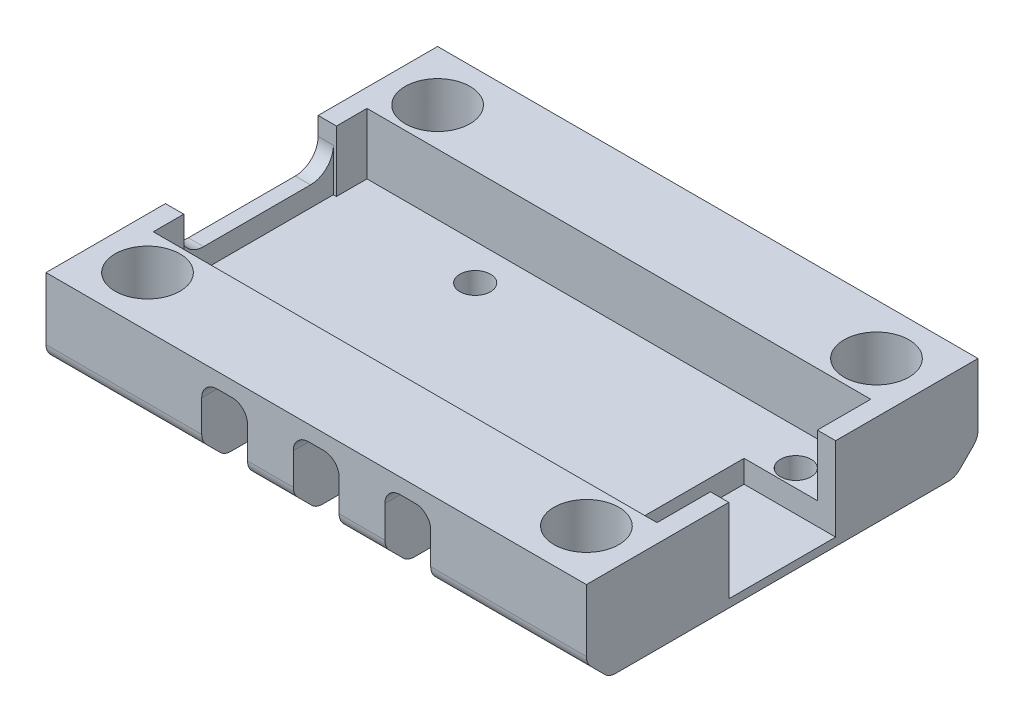
from build123d import *

# Parameters (mm, degrees)
SKETCH1_W           = 35.4
SKETCH1_H           = 25.65
SKETCH1_R           = 2.125
BOSS_EXTRUDE1_DEPTH = 2
SKETCH1_3_R         = 2.125
BOSS_EXTRUDE2_DEPTH = 6
SKETCH2_W           = 3
SKETCH2_H           = 4.5
CUT_EXTRUDE1_DEPTH  = 5
CHAMFER1_SIZE       = 1.5
FILLET1_R           = 1
SKETCH3_W           = 7
SKETCH3_H           = 5.470677448
CUT_EXTRUDE2_DEPTH  = 6
SKETCH4_R           = 1
CUT_EXTRUDE3_DEPTH  = 2
SKETCH5_W           = 10
SKETCH5_H           = 1.310302081
BOSS_EXTRUDE3_DEPTH = 1
FILLET2_R           = 1.5


with BuildPart() as part:
    # Sketch1 → Boss-Extrude1 (new body)
    with BuildSketch(Plane(origin=(0, 0, 0), x_dir=(1, 0, 0), z_dir=(0, 1, 0))):
        with Locations((16.5, 7)):
            Rectangle(SKETCH1_W, SKETCH1_H)
        with Locations(Location((2.125, 16.5, 0), (0, 0, 270))):
            Circle(SKETCH1_R, mode=Mode.SUBTRACT)
        with Locations(Location((2.125, -2.5, 0), (0, 0, 270))):
            Circle(SKETCH1_R, mode=Mode.SUBTRACT)
        with Locations(Location((30.875, -2.5, 0), (0, 0, 270))):
            Circle(SKETCH1_R, mode=Mode.SUBTRACT)
        with Locations(Location((30.875, 16.5, 0), (0, 0, 270))):
            Circle(SKETCH1_R, mode=Mode.SUBTRACT)
    extrude(amount=BOSS_EXTRUDE1_DEPTH)

    # Sketch1<3> → Boss-Extrude2 (add)
    # profile 1 of 2: a face of its own
    with BuildSketch(Plane(origin=(0, 0, 0), x_dir=(1, 0, 0), z_dir=(0, 1, 0))):
        Polygon((33, 0), (0, 0), (0, 2), (-1.2, 2), (-1.2, -5.825), (34.2, -5.825), (34.2, 3.5), (33, 3.5), align=None)
        with Locations(Location((2.125, -2.5, 0), (0, 0, 270))):
            Circle(SKETCH1_3_R, mode=Mode.SUBTRACT)
        with Locations(Location((30.875, -2.5, 0), (0, 0, 270))):
            Circle(SKETCH1_3_R, mode=Mode.SUBTRACT)
    # profile 2 of 2: a face of its own
    with BuildSketch(Plane(origin=(0, 0, 0), x_dir=(1, 0, 0), z_dir=(0, 1, 0))):
        Polygon((-1.2, 12), (0, 12), (0, 14), (33, 14), (33, 10.5), (34.2, 10.5), (34.2, 19.825), (-1.2, 19.825), align=None)
        with Locations(Location((2.125, 16.5, 0), (0, 0, 270))):
            Circle(SKETCH1_3_R, mode=Mode.SUBTRACT)
        with Locations(Location((30.875, 16.5, 0), (0, 0, 270))):
            Circle(SKETCH1_3_R, mode=Mode.SUBTRACT)
    extrude(amount=BOSS_EXTRUDE2_DEPTH)

    # Sketch2 → Cut-Extrude1 (cut)
    with BuildSketch(Plane(origin=(0, 0, 0), x_dir=(-1, 0, 0), z_dir=(0, -1, 0))):
        with Locations((-10.5, -3.575)):
            Rectangle(SKETCH2_W, SKETCH2_H)
        with Locations((-16.5, -3.575)):
            Rectangle(SKETCH2_W, SKETCH2_H)
        with Locations((-22.5, -3.575)):
            Rectangle(SKETCH2_W, SKETCH2_H)
        with Locations((-22.5, 17.575)):
            Rectangle(SKETCH2_W, SKETCH2_H)
        with Locations((-16.5, 17.575)):
            Rectangle(SKETCH2_W, SKETCH2_H)
        with Locations((-10.5, 17.575)):
            Rectangle(SKETCH2_W, SKETCH2_H)
    extrude(amount=-CUT_EXTRUDE1_DEPTH, mode=Mode.SUBTRACT)

    # Chamfer1
    # the kernel refuses this chamfer: 1.5 mm, written as the material it adds along each edge
    with BuildSketch(Plane(origin=(5.142475518, 5, -15.325), x_dir=(0, -0.9996219169112968, 0.027495876610586775), z_dir=(1, 0, 0)), Plane(origin=(11.142475518, 5, -15.325), x_dir=(0, -0.9996219169112968, 0.027495876610586775), z_dir=(1, 0, 0)), Plane(origin=(17.142475518, 5, -15.325), x_dir=(0, -0.9996219169112968, 0.027495876610586775), z_dir=(1, 0, 0)), Plane(origin=(5.142475518, 5, 1.325), x_dir=(0, 0.0274958766105862, 0.9996219169112968), z_dir=(1, 0, 0))) as chamfer1_piece_1:
        Polygon((CHAMFER1_SIZE * 0.999621916911, CHAMFER1_SIZE * 0.0274958766106), (-CHAMFER1_SIZE * 0.0274958766106, CHAMFER1_SIZE * 0.999621916911), (0, 0), align=None)
    extrude(amount=10.715048964)
    with BuildSketch(Plane(origin=(27.857524482, 5, 1.325), x_dir=(0, 0.0274958766105862, 0.9996219169112968), z_dir=(-1, 0, 0)), Plane(origin=(21.857524482, 5, 1.325), x_dir=(0, 0.0274958766105862, 0.9996219169112968), z_dir=(-1, 0, 0))) as chamfer1_piece_2:
        Polygon((CHAMFER1_SIZE * 0.999621916911, -CHAMFER1_SIZE * 0.0274958766106), (-CHAMFER1_SIZE * 0.0274958766106, -CHAMFER1_SIZE * 0.999621916911), (0, 0), align=None)
    extrude(amount=10.715048964)
    # the kernel refuses this chamfer: 1.5 mm, written as the material it takes off along each edge
    with BuildSketch(Plane(origin=(18.857524482, 0, -19.825), x_dir=(0, 0.9996219169112968, -0.027495876610586778), z_dir=(-1, 0, 0)), Plane(origin=(24.857524482, 0, -19.825), x_dir=(0, 0.9996219169112968, -0.027495876610586778), z_dir=(-1, 0, 0)), Plane(origin=(8.142475518, 0, 5.825), x_dir=(0, 0.9996219169112968, 0.027495876610586202), z_dir=(1, 0, 0)), Plane(origin=(14.142475518, 0, 5.825), x_dir=(0, 0.9996219169112968, 0.027495876610586202), z_dir=(1, 0, 0))) as chamfer1_2_piece_1:
        Polygon((CHAMFER1_SIZE * 0.999621916911, -CHAMFER1_SIZE * 0.0274958766106), (-CHAMFER1_SIZE * 0.0274958766106, -CHAMFER1_SIZE * 0.999621916911), (0, 0), align=None)
    extrude(amount=10.715048964, mode=Mode.SUBTRACT)
    with BuildSketch(Plane(origin=(38.057524482, 0, -19.825), x_dir=(0, 0.9996219169112968, -0.027495876610586778), z_dir=(-1, 0, 0)), Plane(origin=(20.142475518, 0, 5.825), x_dir=(0, 0.9996219169112968, 0.027495876610586202), z_dir=(1, 0, 0)), Plane(origin=(-5.057524482, 0, 5.825), x_dir=(0, 0.9996219169112968, 0.027495876610586202), z_dir=(1, 0, 0)), Plane(origin=(12.857524482, 0, -19.825), x_dir=(0, 0.9996219169112968, -0.027495876610586778), z_dir=(-1, 0, 0))) as chamfer1_2_piece_2:
        Polygon((CHAMFER1_SIZE * 0.999621916911, -CHAMFER1_SIZE * 0.0274958766106), (-CHAMFER1_SIZE * 0.0274958766106, -CHAMFER1_SIZE * 0.999621916911), (0, 0), align=None)
    extrude(amount=17.915048964, mode=Mode.SUBTRACT)

    # Fillet1
    # the kernel refuses this fillet: 1 mm, written as the material it adds along each edge
    with BuildSketch(Plane(origin=(21, 0, -15.325), x_dir=(0, 0, -1), z_dir=(0, 1, 0)), Plane(origin=(15, 0, -15.325), x_dir=(0, 0, -1), z_dir=(0, 1, 0)), Plane(origin=(12, 0, -15.325), x_dir=(-1, 0, 0), z_dir=(0, 1, 0)), Plane(origin=(24, 0, -15.325), x_dir=(-1, 0, 0), z_dir=(0, 1, 0)), Plane(origin=(18, 0, -15.325), x_dir=(-1, 0, 0), z_dir=(0, 1, 0)), Plane(origin=(12, 0, 1.325), x_dir=(0, 0, 1), z_dir=(0, 1, 0)), Plane(origin=(18, 0, 1.325), x_dir=(0, 0, 1), z_dir=(0, 1, 0)), Plane(origin=(9, 0, 1.325), x_dir=(1, 0, 0), z_dir=(0, 1, 0)), Plane(origin=(15, 0, 1.325), x_dir=(1, 0, 0), z_dir=(0, 1, 0)), Plane(origin=(21, 0, 1.325), x_dir=(1, 0, 0), z_dir=(0, 1, 0))) as fillet1_piece_1:
        with BuildLine():
            CenterArc((FILLET1_R, -FILLET1_R), FILLET1_R, 90, 90)
            Line((0, -FILLET1_R), (0, 0))
            Line((0, 0), (FILLET1_R, 0))
        make_face()
    extrude(amount=6)
    with BuildSketch(Plane(origin=(21, 5, -19.825), x_dir=(1, 0, 0), z_dir=(0, 0, 1)), Plane(origin=(15, 5, -19.825), x_dir=(1, 0, 0), z_dir=(0, 0, 1)), Plane(origin=(9, 5, -19.825), x_dir=(1, 0, 0), z_dir=(0, 0, 1)), Plane(origin=(12, 5, -14.325), x_dir=(-1, 0, 0), z_dir=(0, 0, -1)), Plane(origin=(24, 5, -14.325), x_dir=(-1, 0, 0), z_dir=(0, 0, -1)), Plane(origin=(18, 5, -14.325), x_dir=(-1, 0, 0), z_dir=(0, 0, -1)), Plane(origin=(15, 5, 0.325), x_dir=(1, 0, 0), z_dir=(0, 0, 1)), Plane(origin=(24, 5, 5.825), x_dir=(-1, 0, 0), z_dir=(0, 0, -1)), Plane(origin=(18, 5, 5.825), x_dir=(-1, 0, 0), z_dir=(0, 0, -1))) as fillet1_piece_2:
        with BuildLine():
            CenterArc((FILLET1_R, -FILLET1_R), FILLET1_R, 90, 90)
            Line((0, -FILLET1_R), (0, 0))
            Line((0, 0), (FILLET1_R, 0))
        make_face()
    extrude(amount=5.5)
    with BuildSketch(Plane(origin=(9, 0, -15.325), x_dir=(1, 0, 0), z_dir=(0, 1, 0)), Plane(origin=(24, 0, 1.325), x_dir=(-1, 0, 0), z_dir=(0, 1, 0))) as fillet1_piece_3:
        with BuildLine():
            CenterArc((FILLET1_R, FILLET1_R), FILLET1_R, 180, 90)
            Line((0, FILLET1_R), (0, 0))
            Line((0, 0), (FILLET1_R, 0))
        make_face()
    extrude(amount=6)
    with BuildSketch(Plane(origin=(21, 5, 0.325), x_dir=(0, -1, 0), z_dir=(0, 0, 1)), Plane(origin=(9, 5, 5.825), x_dir=(1, 0, 0), z_dir=(0, 0, -1)), Plane(origin=(12, 5, 0.325), x_dir=(-1, 0, 0), z_dir=(0, 0, 1))) as fillet1_piece_4:
        with BuildLine():
            CenterArc((FILLET1_R, FILLET1_R), FILLET1_R, 180, 90)
            Line((0, FILLET1_R), (0, 0))
            Line((0, 0), (FILLET1_R, 0))
        make_face()
    extrude(amount=5.5)
    # the kernel refuses this fillet: 1 mm, written as the material it takes off along each edge
    with BuildSketch(Plane(origin=(35.235533906, 0, -18.325), x_dir=(0, 0, 1), z_dir=(-1, 0, 0)), Plane(origin=(2.071956853, 0, -18.325), x_dir=(0, 0, 1), z_dir=(-1, 0, 0)), Plane(origin=(-2.235533906, 0, 4.325), x_dir=(0, 0, -1), z_dir=(1, 0, 0)), Plane(origin=(30.928043147, 0, 4.325), x_dir=(0, 0, -1), z_dir=(1, 0, 0))) as fillet1_2_piece_1:
        with BuildLine():
            CenterArc((FILLET1_R * 0.414213562373, FILLET1_R), FILLET1_R, 225, 45)
            Line((-FILLET1_R * 0.292893218813, FILLET1_R * 0.292893218813), (0, 0))
            Line((0, 0), (FILLET1_R * 0.414213562373, 0))
        make_face()
    extrude(amount=4.307490759, mode=Mode.SUBTRACT)
    with BuildSketch(Plane(origin=(22.964466094, 1.5, -19.825), x_dir=(0, -0.7071067811862655, 0.7071067811868295), z_dir=(1, 0, 0)), Plane(origin=(-2.235533906, 1.5, -19.825), x_dir=(0, -0.7071067811862655, 0.7071067811868295), z_dir=(1, 0, 0))) as fillet1_2_piece_2:
        with BuildLine():
            CenterArc((FILLET1_R * 0.414213562373, -FILLET1_R), FILLET1_R, 90, 45)
            Line((-FILLET1_R * 0.292893218814, -FILLET1_R * 0.292893218814), (0, 0))
            Line((0, 0), (FILLET1_R * 0.414213562373, 0))
        make_face()
    extrude(amount=12.271067812, mode=Mode.SUBTRACT)
    with BuildSketch(Plane(origin=(22.964466094, 0, -18.325), x_dir=(0, 0, 1), z_dir=(1, 0, 0)), Plane(origin=(2.178043147, 0, -18.325), x_dir=(0, 0, 1), z_dir=(1, 0, 0)), Plane(origin=(10.035533906, 0, 4.325), x_dir=(0, 0, -1), z_dir=(-1, 0, 0)), Plane(origin=(30.821956853, 0, 4.325), x_dir=(0, 0, -1), z_dir=(-1, 0, 0))) as fillet1_2_piece_3:
        with BuildLine():
            CenterArc((FILLET1_R * 0.414213562373, -FILLET1_R), FILLET1_R, 90, 45)
            Line((-FILLET1_R * 0.292893218813, -FILLET1_R * 0.292893218813), (0, 0))
            Line((0, 0), (FILLET1_R * 0.414213562373, 0))
        make_face()
    extrude(amount=7.857490759, mode=Mode.SUBTRACT)
    with BuildSketch(Plane(origin=(16.964466094, 1.5, -19.825), x_dir=(0, -0.7071067811862655, 0.7071067811868295), z_dir=(1, 0, 0)), Plane(origin=(16.964466094, 0, -18.325), x_dir=(0, 0, 1), z_dir=(1, 0, 0)), Plane(origin=(10.964466094, 1.5, -19.825), x_dir=(0, -0.7071067811862655, 0.7071067811868295), z_dir=(1, 0, 0)), Plane(origin=(10.964466094, 0, -18.325), x_dir=(0, 0, 1), z_dir=(1, 0, 0)), Plane(origin=(16.035533906, 0, 4.325), x_dir=(0, 0, -1), z_dir=(-1, 0, 0)), Plane(origin=(22.035533906, 0, 4.325), x_dir=(0, 0, -1), z_dir=(-1, 0, 0))) as fillet1_2_piece_4:
        with BuildLine():
            CenterArc((FILLET1_R * 0.414213562373, -FILLET1_R), FILLET1_R, 90, 45)
            Line((-FILLET1_R * 0.292893218814, -FILLET1_R * 0.292893218814), (0, 0))
            Line((0, 0), (FILLET1_R * 0.414213562373, 0))
        make_face()
    extrude(amount=5.071067812, mode=Mode.SUBTRACT)
    with BuildSketch(Plane(origin=(-2.235533906, 1.5, 5.825), x_dir=(0, -0.707106781186265, -0.70710678118683), z_dir=(1, 0, 0)), Plane(origin=(22.964466094, 1.5, 5.825), x_dir=(0, -0.707106781186265, -0.70710678118683), z_dir=(1, 0, 0))) as fillet1_2_piece_5:
        with BuildLine():
            CenterArc((FILLET1_R * 0.414213562373, FILLET1_R), FILLET1_R, 225, 45)
            Line((-FILLET1_R * 0.292893218814, FILLET1_R * 0.292893218814), (0, 0))
            Line((0, 0), (FILLET1_R * 0.414213562373, 0))
        make_face()
    extrude(amount=12.271067812, mode=Mode.SUBTRACT)
    with BuildSketch(Plane(origin=(10.964466094, 1.5, 5.825), x_dir=(0, -0.7071067811862647, -0.7071067811868302), z_dir=(1, 0, 0)), Plane(origin=(16.964466094, 1.5, 5.825), x_dir=(0, -0.7071067811862652, -0.7071067811868297), z_dir=(1, 0, 0))) as fillet1_2_piece_6:
        with BuildLine():
            CenterArc((FILLET1_R * 0.414213562373, FILLET1_R), FILLET1_R, 225, 45)
            Line((-FILLET1_R * 0.292893218814, FILLET1_R * 0.292893218814), (0, 0))
            Line((0, 0), (FILLET1_R * 0.414213562373, 0))
        make_face()
    extrude(amount=5.071067812, mode=Mode.SUBTRACT)

    # Sketch3 → Cut-Extrude2 (cut)
    with BuildSketch(Plane(origin=(34.2, 0, 0), x_dir=(0, 0, -1), z_dir=(1, 0, 0))):
        with Locations((7, 3.264661276)):
            Rectangle(SKETCH3_W, SKETCH3_H)
    extrude(amount=-CUT_EXTRUDE2_DEPTH, mode=Mode.SUBTRACT)

    # Sketch4 → Cut-Extrude3 (cut)
    with BuildSketch(Plane(origin=(0, 2, 0), x_dir=(1, 0, 0), z_dir=(0, 1, 0))):
        with Locations(Location((9.446942501, 11.641698117, 0), (0, 0, 270))):
            Circle(SKETCH4_R)
        with Locations(Location((30.446985681, 11.641698117, 0), (0, 0, 270))):
            Circle(SKETCH4_R)
        with Locations(Location((30.446985681, 2.141677797, 0), (0, 0, 270))):
            Circle(SKETCH4_R)
    extrude(amount=-CUT_EXTRUDE3_DEPTH, mode=Mode.SUBTRACT)

    # Sketch5 → Boss-Extrude3 (add)
    with BuildSketch(Plane.ZY.offset(1.2)):
        with Locations((-7, 2.65515104)):
            Rectangle(SKETCH5_W, SKETCH5_H)
    extrude(amount=-BOSS_EXTRUDE3_DEPTH)

    # Fillet2
    fillet2_edges = [part.edges().sort_by_distance(p)[0] for p in [
        (-0.7, 3.310302081, -12),
        (-0.7, 3.310302081, -2),
    ]]
    fillet(fillet2_edges, radius=FILLET2_R)


solid = part.part
